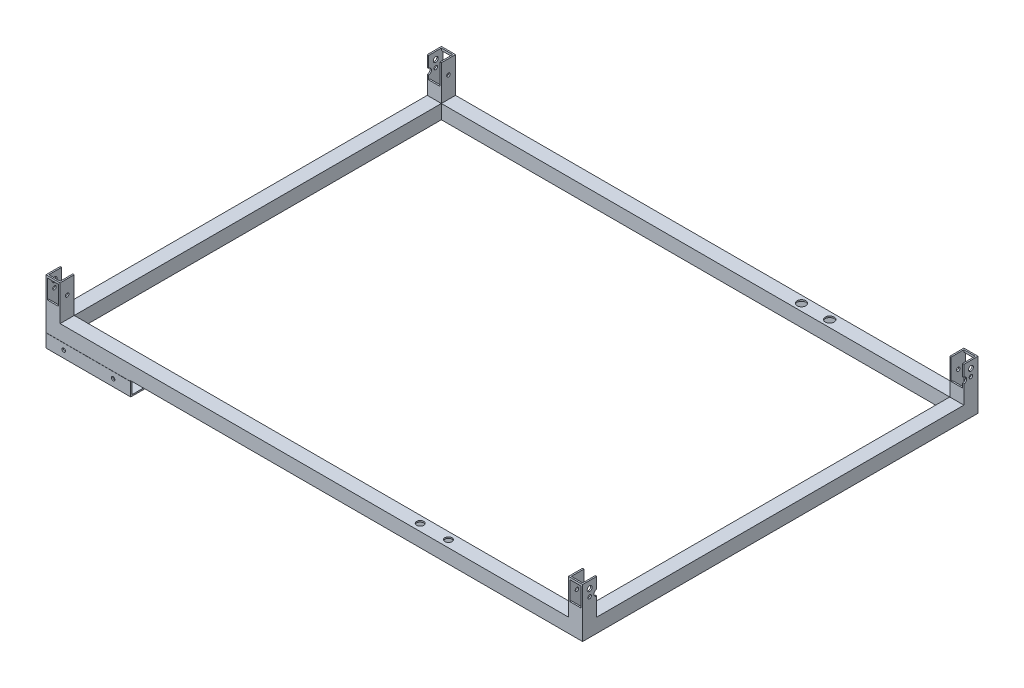
from build123d import *

# Parameters (mm, degrees)
SKETCH2_W                                  = 965.2
SKETCH2_H                                  = 711.2
SKETCH2_W_2                                = 914.4
SKETCH2_H_2                                = 660.4
BASE_FRAME_DEPTH                           = 25.4
SKETCH5_W                                  = 25.4
SKETCH5_H                                  = 25.4
SIDE_FRAME_EXTRUSIONS_DEPTH                = 88.9
SKETCH7_W                                  = 20.32
SKETCH7_H                                  = 20.32
CUT_EXTRUDE4_DEPTH                         = 99.06
SHELL7_OUTLINE_W                           = 20.32
SHELL7_OUTLINE_H                           = 20.32
SHELL7_DEPTH                               = 914.4
SHELL7_START                               = -22.86
SHELL7_2_OUTLINE_W                         = 20.32
SHELL7_2_OUTLINE_H                         = 660.4
SHELL7_2_DEPTH                             = 20.32
SHELL7_START_2                             = 916.94
SHELL7_3_OUTLINE_W                         = 20.32
SHELL7_3_OUTLINE_H                         = 660.4
SHELL7_3_DEPTH                             = 20.32
SIDE_FRAME_BOLT_CUT_OUTS_DEPTH             = 1188.365103917
SIDE_FRAME_BOLT_CUT_OUTS_DEPTH_BACK        = 1188.365103917
SKETCH20_R                                 = 3.175
SKETCH35_W                                 = 20.32
SKETCH35_H                                 = 38.1
SIDE_FRAME_FOLD_DOWN_CUT_OUT_DEPTH         = 1182.919070834
SKETCH36_W                                 = 20.32
SKETCH36_H                                 = 3.81
SIDE_FRAME_STOPPER_RIGHT_DEPTH             = 2.54
SKETCH37_W                                 = 20.32
SKETCH37_H                                 = 3.81
SIDE_FRAME_STOPPER_LEFT_DEPTH              = 2.54
SKETCH39_W                                 = 25.4
SKETCH39_H                                 = 25.4
SKETCH39_W_2                               = 20.32
SKETCH39_H_2                               = 20.32
TOW_ARM_HOLDER_DEPTH                       = 152.4
SKETCH40_R                                 = 3.175
TOW_ARM_PIN_HOLE_CUT_OUT_DEPTH             = 1182.919070834
SKETCH41_W                                 = 152.4
SKETCH41_H                                 = 0.508
TOW_ARM_COSMETIC_GROOVE_CUT_DEPTH          = 0.254
SKETCH46_R                                 = 4.445
PUSH_TAB_HOLE_BACK_SIDE_DEPTH              = 2.54
PUSH_START                                 = -2.54
SKETCH47_R                                 = 4.445
PUSH_TAB_HOLE_FRONT_SIDE_DEPTH             = 2.54
SKETCH51_R                                 = 5.08
PUSH_TAB_SIDE_CUT_THROUGH_BACK_SIDE_DEPTH  = 2.54
BRACKET_HOLES_DEPTH                        = 1167.811420068
BRACKET_HOLES_DEPTH_BACK                   = 1167.811420068
SKETCH56_R                                 = 6.35
SKETCH56_R_2                               = 7.9375
PUSH_TAB_SIDE_CUT_THROUGH_FRONT_SIDE_REACH = 1189.365
SKETCH55_R                                 = 5.08


# Read off the part's stored shape, not the designer's step: Shell7
with BuildPart() as part:
    # Sketch2 → BASE FRAME (new body)
    with BuildSketch(Plane(origin=(0, 0, 0), x_dir=(1, 0, 0), z_dir=(0, 1, 0))):
        with Locations((457.2, 330.2)):
            Rectangle(SKETCH2_W, SKETCH2_H)
        with Locations((457.2, 330.2)):
            Rectangle(SKETCH2_W_2, SKETCH2_H_2, mode=Mode.SUBTRACT)
    extrude(amount=BASE_FRAME_DEPTH)

    # Sketch5 → SIDE FRAME EXTRUSIONS (add)
    with BuildSketch(Plane(origin=(0, 0, 0), x_dir=(1, 0, 0), z_dir=(0, 1, 0))):
        with Locations((-12.7, -12.7)):
            Rectangle(SKETCH5_W, SKETCH5_H)
        with Locations((927.1, -12.7)):
            Rectangle(SKETCH5_W, SKETCH5_H)
        with Locations((927.1, 673.1)):
            Rectangle(SKETCH5_W, SKETCH5_H)
        with Locations((-12.7, 673.1)):
            Rectangle(SKETCH5_W, SKETCH5_H)
    extrude(amount=SIDE_FRAME_EXTRUSIONS_DEPTH)

    # Sketch7 → Cut-Extrude4 (cut)
    with BuildSketch(Plane(origin=(0, 88.9, 0), x_dir=(1, 0, 0), z_dir=(0, 1, 0))):
        with Locations((-12.7, -12.7)):
            Rectangle(SKETCH7_W, SKETCH7_H)
        with Locations((-12.7, 673.1)):
            Rectangle(SKETCH7_W, SKETCH7_H)
        with Locations((927.1, 673.1)):
            Rectangle(SKETCH7_W, SKETCH7_H)
        with Locations((927.1, -12.7)):
            Rectangle(SKETCH7_W, SKETCH7_H)
    extrude(amount=-CUT_EXTRUDE4_DEPTH, mode=Mode.SUBTRACT)

    # Shell7 outline → Shell7 (cut)
    with BuildSketch(Plane.YZ):
        with Locations((12.7, -673.1)):
            Rectangle(SHELL7_OUTLINE_W, SHELL7_OUTLINE_H)
        with Locations((12.7, 12.7)):
            Rectangle(SHELL7_OUTLINE_W, SHELL7_OUTLINE_H)
    extrude(amount=SHELL7_DEPTH, mode=Mode.SUBTRACT)

    # Shell7 2 outline → Shell7 2 (cut)
    with BuildSketch(Plane.YZ.offset(SHELL7_START)):
        with Locations((12.7, -330.2)):
            Rectangle(SHELL7_2_OUTLINE_W, SHELL7_2_OUTLINE_H)
    extrude(amount=SHELL7_2_DEPTH, mode=Mode.SUBTRACT)

    # Shell7 3 outline → Shell7 3 (cut)
    with BuildSketch(Plane.YZ.offset(SHELL7_START_2)):
        with Locations((12.7, -330.2)):
            Rectangle(SHELL7_3_OUTLINE_W, SHELL7_3_OUTLINE_H)
    extrude(amount=SHELL7_3_DEPTH, mode=Mode.SUBTRACT)

    # Sketch20 → SIDE FRAME BOLT CUT OUTS (cut, two sides: drawn at the far end of the back side and taken through both)
    with BuildSketch(Plane.ZY.offset(25.4).offset(-SIDE_FRAME_BOLT_CUT_OUTS_DEPTH_BACK)):
        with Locations((12.7, 63.5)):
            Circle(SKETCH20_R)
        with Locations((-673.1, 63.5)):
            Circle(SKETCH20_R)
    extrude(amount=SIDE_FRAME_BOLT_CUT_OUTS_DEPTH + SIDE_FRAME_BOLT_CUT_OUTS_DEPTH_BACK, mode=Mode.SUBTRACT)

    # Sketch35 → SIDE FRAME FOLD DOWN CUT OUT (cut, through all)
    with BuildSketch(Plane.XY.offset(25.4)):
        with Locations((-12.7, 69.85)):
            Rectangle(SKETCH35_W, SKETCH35_H)
        with Locations((927.1, 69.85)):
            Rectangle(SKETCH35_W, SKETCH35_H)
    extrude(amount=-SIDE_FRAME_FOLD_DOWN_CUT_OUT_DEPTH, mode=Mode.SUBTRACT)

    # Sketch36 → SIDE FRAME STOPPER RIGHT (add)
    with BuildSketch(Plane.XY.offset(25.4)):
        with Locations((-12.7, 86.995)):
            Rectangle(SKETCH36_W, SKETCH36_H)
        with Locations((927.1, 86.995)):
            Rectangle(SKETCH36_W, SKETCH36_H)
    extrude(amount=-SIDE_FRAME_STOPPER_RIGHT_DEPTH)

    # Sketch37 → SIDE FRAME STOPPER LEFT (add)
    with BuildSketch(Plane(origin=(0, 0, -685.8), x_dir=(-1, 0, 0), z_dir=(0, 0, -1))):
        with Locations((-927.1, 86.995)):
            Rectangle(SKETCH37_W, SKETCH37_H)
        with Locations((12.7, 86.995)):
            Rectangle(SKETCH37_W, SKETCH37_H)
    extrude(amount=-SIDE_FRAME_STOPPER_LEFT_DEPTH)

    # Sketch39 → TOW ARM HOLDER (add)
    with BuildSketch(Plane.ZY.offset(25.4)):
        with Locations((12.7, -12.7)):
            Rectangle(SKETCH39_W, SKETCH39_H)
        with Locations((12.7, -12.7)):
            Rectangle(SKETCH39_W_2, SKETCH39_H_2, mode=Mode.SUBTRACT)
    extrude(amount=-TOW_ARM_HOLDER_DEPTH)

    # Sketch40 → TOW ARM PIN HOLE CUT OUT (cut, through all)
    with BuildSketch(Plane.XY.offset(25.4)):
        with Locations((6.35, -12.7)):
            Circle(SKETCH40_R)
        with Locations((95.25, -12.7)):
            Circle(SKETCH40_R)
    extrude(amount=-TOW_ARM_PIN_HOLE_CUT_OUT_DEPTH, mode=Mode.SUBTRACT)

    # Sketch41 → TOW ARM COSMETIC GROOVE CUT (cut)
    with BuildSketch(Plane.XY.offset(25.4)):
        with Locations((50.8, -1.357172644)):
            Rectangle(SKETCH41_W, SKETCH41_H)
    extrude(amount=-TOW_ARM_COSMETIC_GROOVE_CUT_DEPTH, mode=Mode.SUBTRACT)

    # Sketch46 → PUSH TAB HOLE BACK SIDE (cut)
    with BuildSketch(Plane(origin=(939.8, 0, 0), x_dir=(0, 0, -1), z_dir=(1, 0, 0))):
        with Locations((-12.7, 76.2)):
            Circle(SKETCH46_R)
        with Locations((673.1, 76.2)):
            Circle(SKETCH46_R)
    extrude(amount=-PUSH_TAB_HOLE_BACK_SIDE_DEPTH, mode=Mode.SUBTRACT)

    # Sketch47 → PUSH TAB HOLE FRONT SIDE (cut)
    with BuildSketch(Plane.ZY.offset(25.4).offset(PUSH_START)):
        with Locations(Location((12.7, 76.2, 0), (0, 0, 180))):
            Circle(SKETCH47_R)
        with Locations(Location((-673.1, 76.2, 0), (0, 0, 180))):
            Circle(SKETCH47_R)
    extrude(amount=PUSH_TAB_HOLE_FRONT_SIDE_DEPTH, mode=Mode.SUBTRACT)

    # Sketch51 → PUSH TAB SIDE CUT THROUGH BACK SIDE (cut)
    with BuildSketch(Plane(origin=(939.8, 0, 0), x_dir=(0, 0, -1), z_dir=(1, 0, 0))):
        with Locations((0, 63.5)):
            Circle(SKETCH51_R)
        with Locations((660.4, 63.5)):
            Circle(SKETCH51_R)
    extrude(amount=-PUSH_TAB_SIDE_CUT_THROUGH_BACK_SIDE_DEPTH, mode=Mode.SUBTRACT)

    # Sketch56 → BRACKET HOLES (cut, two sides: drawn at the far end of the back side and taken through both)
    with BuildSketch(Plane(origin=(0, 0, 0), x_dir=(1, 0, 0), z_dir=(0, 1, 0)).offset(-BRACKET_HOLES_DEPTH_BACK)):
        with Locations(Location((635, -12.7, 0), (0, 0, 270))):
            Circle(SKETCH56_R)
        with Locations(Location((685.8, -12.7, 0), (0, 0, 270))):
            Circle(SKETCH56_R)
        with Locations(Location((635, 673.1, 0), (0, 0, 270))):
            Circle(SKETCH56_R_2)
        with Locations(Location((685.8, 673.1, 0), (0, 0, 270))):
            Circle(SKETCH56_R_2)
    extrude(amount=BRACKET_HOLES_DEPTH + BRACKET_HOLES_DEPTH_BACK, mode=Mode.SUBTRACT)

    # Sketch55 → PUSH TAB SIDE CUT THROUGH FRONT SIDE (cut, up to next)
    with BuildSketch(Plane.ZY.offset(25.4), mode=Mode.PRIVATE) as push_tab_side_cut_through_front_side_sk1:
        with Locations((-660.4, 63.5)):
            Circle(SKETCH55_R)
    push_tab_side_cut_through_front_side_tool1 = extrude(push_tab_side_cut_through_front_side_sk1.sketch, amount=-PUSH_TAB_SIDE_CUT_THROUGH_FRONT_SIDE_REACH, mode=Mode.PRIVATE) & part.part
    # Sketch55 → PUSH TAB SIDE CUT THROUGH FRONT SIDE (cut, up to next)
    with BuildSketch(Plane.ZY.offset(25.4), mode=Mode.PRIVATE) as push_tab_side_cut_through_front_side_sk2:
        with Locations((0, 63.5)):
            Circle(SKETCH55_R)
    push_tab_side_cut_through_front_side_tool2 = extrude(push_tab_side_cut_through_front_side_sk2.sketch, amount=-PUSH_TAB_SIDE_CUT_THROUGH_FRONT_SIDE_REACH, mode=Mode.PRIVATE) & part.part
    add(push_tab_side_cut_through_front_side_tool1.solids().sort_by_distance((-25.4, 63.5, -660.4))[0], mode=Mode.SUBTRACT)
    add(push_tab_side_cut_through_front_side_tool2.solids().sort_by_distance((-25.4, 63.5, 0))[0], mode=Mode.SUBTRACT)


solid = part.part
